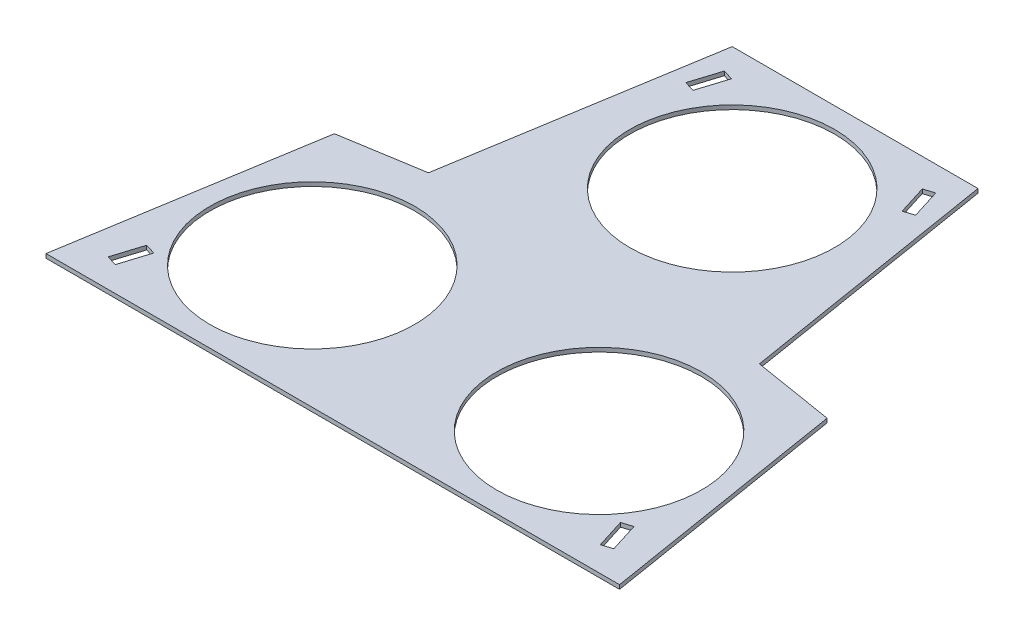
from build123d import *

# Parameters (mm, degrees)
SKETCH1_R           = 50
BOSS_EXTRUDE1_DEPTH = 2
CUT_EXTRUDE1_DEPTH  = 5


with BuildPart() as part:
    # Sketch1 → Boss-Extrude1 (new body)
    with BuildSketch(Plane(origin=(0, 0, 0), x_dir=(1, 0, 0), z_dir=(0, 1, 0))):
        Polygon((-140, 0), (140, 0), (120.264015595, 121.064121849), (80.785167176, 127.5), (60, 255), (-60, 255), (-80.785167176, 127.5), (-120.264015595, 121.064121849), align=None)
        with Locations((0, 195)):
            Circle(SKETCH1_R, mode=Mode.SUBTRACT)
        with Locations((-70, 60)):
            Circle(SKETCH1_R, mode=Mode.SUBTRACT)
        with Locations((70, 60)):
            Circle(SKETCH1_R, mode=Mode.SUBTRACT)
    extrude(amount=BOSS_EXTRUDE1_DEPTH)

    # Sketch2 → Cut-Extrude1 (cut)
    with BuildSketch(Plane(origin=(0, 2, 0), x_dir=(1, 0, 0), z_dir=(0, 1, 0))):
        Polygon((-56.073926703, 228.471148892), (-51.583825585, 242.783346206), (-46.574556526, 241.211810815), (-51.064657644, 226.899613501), align=None)
        Polygon((-118.416174415, 12.216653794), (-113.926073297, 26.528851108), (-118.935342356, 28.100386499), (-123.425443474, 13.788189185), align=None)
        Polygon((123.425443474, 13.788189185), (118.935342356, 28.100386499), (113.926073297, 26.528851108), (118.416174415, 12.216653794), align=None)
        Polygon((51.064657644, 226.899613501), (46.574556526, 241.211810815), (51.583825585, 242.783346206), (56.073926703, 228.471148892), align=None)
    extrude(amount=-CUT_EXTRUDE1_DEPTH, mode=Mode.SUBTRACT)


solid = part.part
